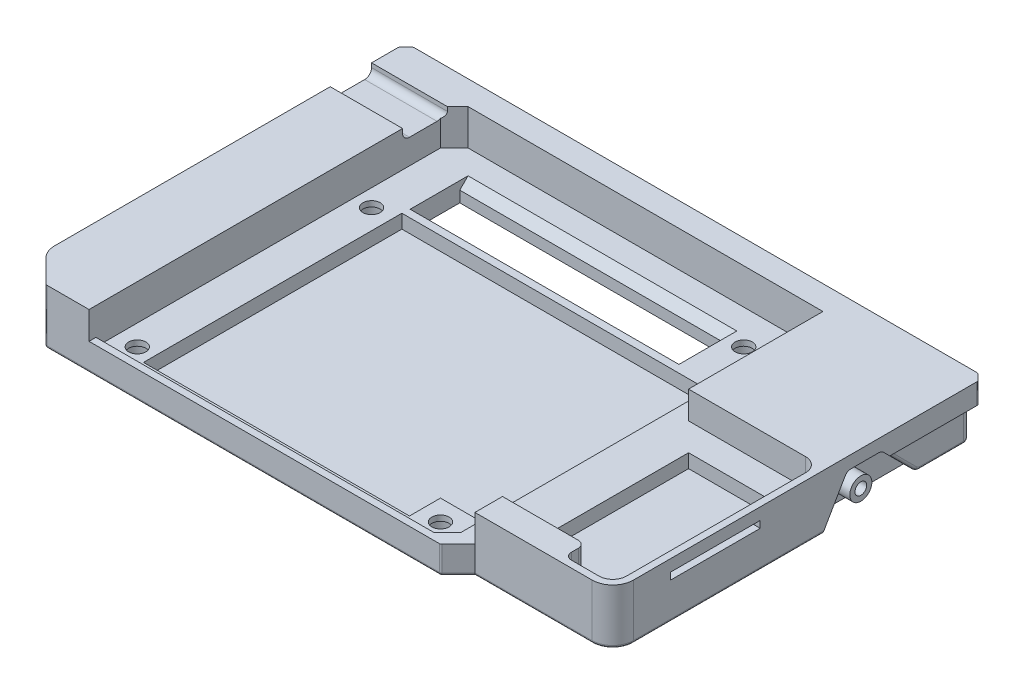
from build123d import *

# Parameters (mm, degrees)
SKETCH_1_W           = 84
SKETCH_1_H           = 54
EXTRUDE_1_DEPTH      = 8
SKETCH_2_W           = 60
SKETCH_2_H           = 2.5
EXTRUDE_2_DEPTH      = 8
CHAMFER_1_SIZE       = 4
FILLET_1_R           = 3
SKETCH_3_W           = 1
SKETCH_3_H           = 4
CUT_EXTRUDE_1_DEPTH  = 101.179838291
CUT_EXTRUDE_2_DEPTH  = 1.1
CUT_EXTRUDE_START    = -84
CUT_EXTRUDE_3_DEPTH  = 1.1
FILLET_2_R           = 1
CHAMFER_2_SIZE       = 1
CUT_EXTRUDE_4_DEPTH  = 1.9
CUT_EXTRUDE_START_2  = -81.8
CUT_EXTRUDE_5_DEPTH  = 1.9
FILLET_3_R           = 1
CHAMFER_4_SIZE       = 1
SKETCH_6_R           = 1.6
EXTRUDE_3_DEPTH      = 3
EXTRUDE_START        = -81
SKETCH_6_2_R         = 1.6
EXTRUDE_4_DEPTH      = 3
SKETCH_7_R           = 0.85
CUT_EXTRUDE_6_DEPTH  = 7
CUT_EXTRUDE_START_3  = -77
SKETCH_7_2_R         = 0.85
CUT_EXTRUDE_7_DEPTH  = 7
FILLET_4_R           = 0.5
SKETCH_8_W           = 53.5
SKETCH_8_H           = 53
CUT_EXTRUDE_8_DEPTH  = 4
CUT_EXTRUDE_9_DEPTH  = 1.2
CHAMFER_5_SIZE       = 2
SKETCH_11_R          = 1.25
CUT_EXTRUDE_10_DEPTH = 100.995199885
CUT_EXTRUDE_13_DEPTH = 101.179838291
FILLET_5_R           = 0.4
FILLET_6_R           = 0.4
CUT_EXTRUDE_14_DEPTH = 2
SKETCH_16_W          = 39
SKETCH_16_H          = 6
CUT_EXTRUDE_15_DEPTH = 101.179838291
CHAMFER_6_SIZE       = 1.2
SKETCH_17_W          = 14
SKETCH_17_H          = 6
CUT_EXTRUDE_16_DEPTH = 1.6
CUT_EXTRUDE_18_DEPTH = 4
SKETCH_21_W          = 15
SKETCH_21_H          = 22
CUT_EXTRUDE_19_DEPTH = 2
OTHER_1_OUTLINE_R    = 2.05
OTHER_1_OUTLINE_R_2  = 1.25
OTHER_1_DEPTH        = 2
FILLET_8_R           = 1
CUT_EXTRUDE_20_REACH = 102.18


# Read off the part's stored shape, not the designer's step: 高级异型孔1
# Some blends are built 0.0001 mm under size
with BuildPart() as part:
    # 草图1 → 凸台-拉伸1 (new body)
    with BuildSketch(Plane(origin=(0, 0, 0), x_dir=(1, 0, 0), z_dir=(0, 1, 0))):
        with Locations((42, 27)):
            Rectangle(SKETCH_1_W, SKETCH_1_H)
    extrude(amount=EXTRUDE_1_DEPTH)

    # 草图2 → 凸台-拉伸2 (add)
    with BuildSketch(Plane.XZ):
        with Locations((30, 1.25)):
            Rectangle(SKETCH_2_W, SKETCH_2_H)
    extrude(amount=-EXTRUDE_2_DEPTH)

    # 倒角1
    # the kernel refuses this chamfer: 4 mm, written as the material it adds along each edge
    with BuildSketch(Plane(origin=(60, 0, 0), x_dir=(0.9996219169112968, 0, -0.02749587661058639), z_dir=(0, 1, 0))) as chamfer_1_piece_1_section:
        Polygon((CHAMFER_1_SIZE * 0.999621916911, -CHAMFER_1_SIZE * 0.0274958766106), (-CHAMFER_1_SIZE * 0.0274958766106, -CHAMFER_1_SIZE * 0.999621916911), (0, 0), align=None)
    chamfer_1_piece_1 = extrude(amount=8, mode=Mode.PRIVATE)
    chamfer_1_piece_1 = split(chamfer_1_piece_1, bisect_by=Plane(origin=(61.48305822, 4, 2.5), z_dir=(0, 0, -1)), keep=Keep.TOP, mode=Mode.PRIVATE)
    add(chamfer_1_piece_1)

    # 圆角1
    fillet_1_edges = [part.edges().sort_by_distance(p)[0] for p in [
        (84, 4, 0),
    ]]
    fillet(fillet_1_edges, radius=FILLET_1_R)

    # 草图3 → 切除-拉伸1 (cut, through all)
    with BuildSketch(Plane.ZY):
        with Locations((-53.5, 2)):
            Rectangle(SKETCH_3_W, SKETCH_3_H)
    extrude(amount=-CUT_EXTRUDE_1_DEPTH, mode=Mode.SUBTRACT)

    # 草图4 → 切除-拉伸2 (cut)
    with BuildSketch(Plane.ZY):
        Polygon((-34, 6.2), (-30.420428331, 0), (-53, 0), (-53, 4), (-41.2, 4), (-39, 6.2), align=None)
    extrude(amount=-CUT_EXTRUDE_2_DEPTH, mode=Mode.SUBTRACT)

    # 草图4<3> → 切除-拉伸3 (cut)
    with BuildSketch(Plane.ZY.offset(CUT_EXTRUDE_START)):
        Polygon((-34, 6.2), (-30.420428331, 0), (-53, 0), (-53, 4), (-41.2, 4), (-39, 6.2), align=None)
    extrude(amount=CUT_EXTRUDE_3_DEPTH, mode=Mode.SUBTRACT)

    # 圆角2
    fillet_2_edges = [part.edges().sort_by_distance(p)[0] for p in [
        (1.1, 2, -53),
        (82.9, 2, -53),
    ]]
    fillet(fillet_2_edges, radius=FILLET_2_R)

    # 倒角2
    chamfer_2_edges = [part.edges().sort_by_distance(p)[0] for p in [
        (0, 6, -54),
        (84, 6, -54),
    ]]
    chamfer(chamfer_2_edges, length=CHAMFER_2_SIZE)

    # 草图5 → 切除-拉伸4 (cut)
    with BuildSketch(Plane.ZY.offset(-1.1)):
        Polygon((-45.2, 0), (-30.420428331, 0), (-34, 6.2), (-39, 6.2), align=None)
    extrude(amount=-CUT_EXTRUDE_4_DEPTH, mode=Mode.SUBTRACT)

    # 草图5<2> → 切除-拉伸5 (cut)
    with BuildSketch(Plane.ZY.offset(-1.1).offset(CUT_EXTRUDE_START_2)):
        Polygon((-39, 6.2), (-41.2, 4), (-45.2, 0), (-30.420428331, 0), (-34, 6.2), align=None)
    extrude(amount=CUT_EXTRUDE_5_DEPTH, mode=Mode.SUBTRACT)

    # 圆角3
    fillet_3_edges = [part.edges().sort_by_distance(p)[0] for p in [
        (2.05, 0, -45.2),
        (81.95, 0, -45.2),
        (1.5, 6.2, -39),
        (1.5, 6.2, -34),
        (82.5, 6.2, -34),
        (82.5, 6.2, -39),
    ]]
    fillet(fillet_3_edges, radius=FILLET_3_R)

    # 倒角4
    chamfer_4_edges = [part.edges().sort_by_distance(p)[0] for p in [
        (42, 4, -54),
        (83.5, 4, -53.5),
        (0.5, 4, -53.5),
        (84, 4, -47.1),
        (0, 4, -47.1),
    ]]
    chamfer(chamfer_4_edges, length=CHAMFER_4_SIZE - 0.0001)  # a hair under: the kernel refuses the full size

    # 草图6 → 凸台-拉伸3 (add)
    with BuildSketch(Plane.ZY.offset(-3)):
        with Locations((-36, 3)):
            Circle(SKETCH_6_R)
    extrude(amount=EXTRUDE_3_DEPTH)

    # 草图6<2> → 凸台-拉伸4 (add)
    with BuildSketch(Plane.ZY.offset(-3).offset(EXTRUDE_START)):
        with Locations((-36, 3)):
            Circle(SKETCH_6_2_R)
    extrude(amount=EXTRUDE_4_DEPTH)

    # 草图7 → 切除-拉伸6 (cut)
    with BuildSketch(Plane.ZY):
        with Locations((-36, 3)):
            Circle(SKETCH_7_R)
    extrude(amount=-CUT_EXTRUDE_6_DEPTH, mode=Mode.SUBTRACT)

    # 草图7<2> → 切除-拉伸7 (cut)
    with BuildSketch(Plane.ZY.offset(CUT_EXTRUDE_START_3)):
        with Locations((-36, 3)):
            Circle(SKETCH_7_2_R)
    extrude(amount=-CUT_EXTRUDE_7_DEPTH, mode=Mode.SUBTRACT)

    # 圆角4
    fillet_4_edges = [part.edges().sort_by_distance(p)[0] for p in [
        (0, 6.49995, -53),
        (83, 6.49995, -54),
        (1, 6.49995, -54),
        (84, 6.49995, -53),
    ]]
    fillet(fillet_4_edges, radius=FILLET_4_R)

    # 草图8 → 切除-拉伸8 (cut)
    with BuildSketch(Plane(origin=(0, 8, 0), x_dir=(1, 0, 0), z_dir=(0, 1, 0))):
        with Locations((37.25, 24)):
            Rectangle(SKETCH_8_W, SKETCH_8_H)
    extrude(amount=-CUT_EXTRUDE_8_DEPTH, mode=Mode.SUBTRACT)

    # 草图10 → 切除-拉伸9 (cut)
    with BuildSketch(Plane(origin=(0, 4, 0), x_dir=(1, 0, 0), z_dir=(0, 1, 0))):
        Polygon((10.5, -1.5), (59.5, -1.5), (61.5, 0.5), (61.5, 50.5), (10.5, 50.5), align=None)
    extrude(amount=-CUT_EXTRUDE_9_DEPTH, mode=Mode.SUBTRACT)

    # 倒角5
    chamfer_5_edges = [part.edges().sort_by_distance(p)[0] for p in [
        (10.5, 5.4, -50.5),
    ]]
    chamfer(chamfer_5_edges, length=CHAMFER_5_SIZE)

    # 草图11 → 切除-拉伸10 (cut, through all)
    with BuildSketch(Plane(origin=(0, 2.8, 0), x_dir=(1, 0, 0), z_dir=(0, 1, 0))):
        with Locations(Location((13.5, 1.5, 0), (0, 0, 270))):
            Circle(SKETCH_11_R)
        with Locations(Location((57.5, 1.5, 0), (0, 0, 270))):
            Circle(SKETCH_11_R)
        with Locations(Location((57.5, 45.5, 0), (0, 0, 270))):
            Circle(SKETCH_11_R)
        with Locations(Location((13, 36, 0), (0, 0, 270))):
            Circle(SKETCH_11_R)
    extrude(amount=-CUT_EXTRUDE_10_DEPTH, mode=Mode.SUBTRACT)

    # 草图14 → 切除-拉伸13 (cut, through all)
    with BuildSketch(Plane(origin=(0, 8, 0), x_dir=(1, 0, 0), z_dir=(0, 1, 0))):
        with BuildLine():
            Line((4.257359313, -2.5), (0, -2.5))
            Line((0, -2.5), (0, 3))
            ThreePointArc((0, 3), (0.228361402, 1.851949703), (0.878679656, 0.878679656))
            Line((0.878679656, 0.878679656), (4.257359313, -2.5))
        make_face()
    extrude(amount=-CUT_EXTRUDE_13_DEPTH, mode=Mode.SUBTRACT)

    # 圆角5
    fillet_5_edges = [part.edges().sort_by_distance(p)[0] for p in [
        (61.5, 2, 2.5),
        (4.257359313, 4, 2.5),
    ]]
    fillet(fillet_5_edges, radius=FILLET_5_R)

    # 圆角6
    fillet_6_edges = [part.edges().sort_by_distance(p)[0] for p in [
        (82.9, 2.146446609, -43.053553391),
        (82.9, 0.076120467, -45.23153013),
        (1.1, 2.146446609, -43.053553391),
        (1.1, 0.076120467, -45.23153013),
        (72.5, 0, 0),
        (62.808578644, 0, 1.191421356),
        (0.228361402, 0, -1.851949703),
        (32.878679656, 0, 2.5),
        (84, 0, -16.710214166),
        (2.509440841, 0, 0.752081528),
        (4.269971365, 0, 2.469551813),
        (61.487387948, 0, 2.469551813),
        (83.121320344, 0, -0.878679656),
        (0, 0, -16.710214166),
        (1.1, 0, -48.807106781),
        (82.9, 0, -48.807106781),
        (42, 0, -53),
        (82.607106781, 0, -52.707106781),
        (1.392893219, 0, -52.707106781),
    ]]
    fillet(fillet_6_edges, radius=FILLET_6_R)

    # 草图15 → 切除-拉伸14 (cut)
    with BuildSketch(Plane(origin=(0, 2.8, 0), x_dir=(1, 0, 0), z_dir=(0, 1, 0))):
        Polygon((15.9, 37.5), (61.5, 37.5), (61.5, 4.5), (54.5, 4.5), (54.5, 0), (15.9, 0), align=None)
    extrude(amount=-CUT_EXTRUDE_14_DEPTH, mode=Mode.SUBTRACT)

    # 草图16 → 切除-拉伸15 (cut, through all)
    with BuildSketch(Plane.XZ):
        with Locations((35.5, -42.8)):
            Rectangle(SKETCH_16_W, SKETCH_16_H)
    extrude(amount=-CUT_EXTRUDE_15_DEPTH, mode=Mode.SUBTRACT)

    # 倒角6
    chamfer_6_edges = [part.edges().sort_by_distance(p)[0] for p in [
        (35.5, 2.8, -39.8),
        (35.5, 2.8, -45.8),
    ]]
    chamfer(chamfer_6_edges, length=CHAMFER_6_SIZE)

    # 草图17 → 切除-拉伸16 (cut)
    with BuildSketch(Plane(origin=(0, 8, 0), x_dir=(1, 0, 0), z_dir=(0, 1, 0))):
        with Locations((7, 46)):
            Rectangle(SKETCH_17_W, SKETCH_17_H)
    extrude(amount=-CUT_EXTRUDE_16_DEPTH, mode=Mode.SUBTRACT)

    # 草图20 → 切除-拉伸18 (cut)
    with BuildSketch(Plane(origin=(0, 8, 0), x_dir=(1, 0, 0), z_dir=(0, 1, 0))):
        with BuildLine():
            Line((64, 31), (81, 31))
            ThreePointArc((81, 31), (82.414213562, 30.414213562), (83, 29))
            Line((83, 29), (83, 3))
            ThreePointArc((83, 3), (82.414213562, 1.585786438), (81, 1))
            Line((81, 1), (77, 1))
            ThreePointArc((77, 1), (76.292893219, 1.292893219), (76, 2))
            Line((76, 2), (76, 3))
            ThreePointArc((76, 3), (75.707106781, 3.707106781), (75, 4))
            Line((75, 4), (64, 4))
            Line((64, 4), (64, 31))
        make_face()
    extrude(amount=-CUT_EXTRUDE_18_DEPTH, mode=Mode.SUBTRACT)

    # 草图21 → 切除-拉伸19 (cut)
    with BuildSketch(Plane(origin=(0, 4, 0), x_dir=(1, 0, 0), z_dir=(0, 1, 0))):
        with Locations((75.5, 16)):
            Rectangle(SKETCH_21_W, SKETCH_21_H)
    extrude(amount=-CUT_EXTRUDE_19_DEPTH, mode=Mode.SUBTRACT)

    # 高级异型孔1 outline → 高级异型孔1 (cut)
    # profile 1 of 4: a face of its own
    with BuildSketch(Plane(origin=(0, 0, 0), x_dir=(1, 0, 0), z_dir=(0, 1, 0))):
        with Locations((13, 36)):
            Circle(OTHER_1_OUTLINE_R)
        with Locations((13, 36)):
            Circle(OTHER_1_OUTLINE_R_2, mode=Mode.SUBTRACT)
    # profile 2 of 4: a face of its own
    with BuildSketch(Plane(origin=(0, 0, 0), x_dir=(1, 0, 0), z_dir=(0, 1, 0))):
        with Locations((13.5, 1.5)):
            Circle(OTHER_1_OUTLINE_R)
        with Locations((13.5, 1.5)):
            Circle(OTHER_1_OUTLINE_R_2, mode=Mode.SUBTRACT)
    # profile 3 of 4: a face of its own
    with BuildSketch(Plane(origin=(0, 0, 0), x_dir=(1, 0, 0), z_dir=(0, 1, 0))):
        with Locations((57.5, 1.5)):
            Circle(OTHER_1_OUTLINE_R)
        with Locations((57.5, 1.5)):
            Circle(OTHER_1_OUTLINE_R_2, mode=Mode.SUBTRACT)
    # profile 4 of 4: a face of its own
    with BuildSketch(Plane(origin=(0, 0, 0), x_dir=(1, 0, 0), z_dir=(0, 1, 0))):
        with Locations((57.5, 45.5)):
            Circle(OTHER_1_OUTLINE_R)
        with Locations((57.5, 45.5)):
            Circle(OTHER_1_OUTLINE_R_2, mode=Mode.SUBTRACT)
    extrude(amount=OTHER_1_DEPTH, mode=Mode.SUBTRACT)

    # 圆角8
    fillet_8_edges = [part.edges().sort_by_distance(p)[0] for p in [
        (5.25, 6.4, -43),
        (5.5, 6.4, -49),
    ]]
    fillet(fillet_8_edges, radius=FILLET_8_R)

    # 草图24 → 切除-拉伸20 (cut, up to next)
    with BuildSketch(Plane(origin=(84, 0, 0), x_dir=(0, 0, -1), z_dir=(1, 0, 0)), mode=Mode.PRIVATE) as cut_extrude_20_sk1:
        Polygon((21.4, 5.3), (15.4, 5.3), (14.4, 5.3), (8.4, 5.3), (8.4, 6.3), (14.4, 6.3), (15.4, 6.3), (21.4, 6.3), align=None)
    cut_extrude_20_tool1 = extrude(cut_extrude_20_sk1.sketch, amount=-CUT_EXTRUDE_20_REACH, mode=Mode.PRIVATE) & part.part
    add(cut_extrude_20_tool1.solids().sort_by_distance((84, 5.8, -14.9))[0], mode=Mode.SUBTRACT)


solid = part.part
